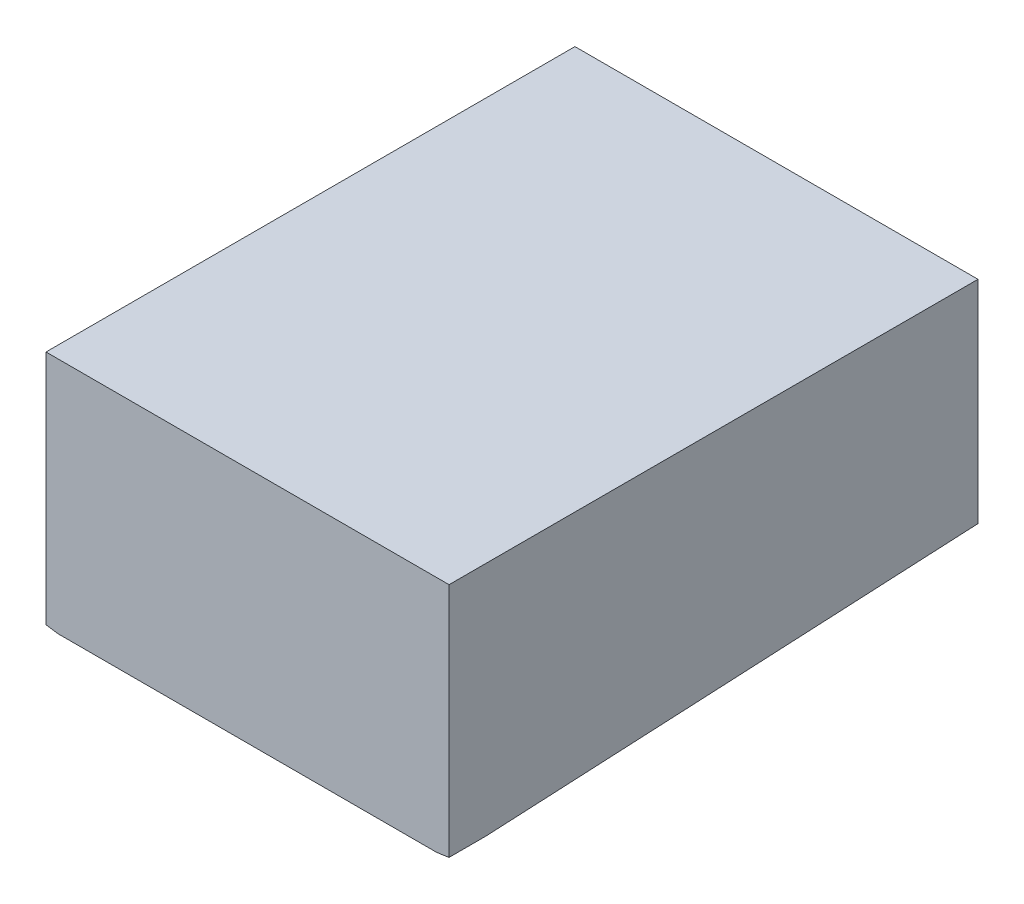
from build123d import *

# Parameters (mm, degrees)
BOSS_EXTRUDE1_DEPTH     = 200
CUT_EXTRUDE1_DEPTH      = 241.63756996204893
CUT_EXTRUDE1_DEPTH_BACK = 241.63756996204893


with BuildPart() as part:
    # Sketch17 → Boss-Extrude1 (new body)
    with BuildSketch(Plane.XY):
        with BuildLine():
            Line((-76.19999999999997, -15), (76.2, -14.99999999999998))
            Line((76.2, -14.99999999999998), (76.19999999999918, -104.30840989584696))
            add(Edge.make_bspline(
                [(-76.19999999999918, -104.30840989584696), (2.649e-14, -116.002151811939), (76.19999999999918, -104.30840989584696)],
                knots=[1.2477044197570988, 1.2477044197570988, 1.2477044197570988, 1.8938882338326948, 1.8938882338326948, 1.8938882338326948], degree=2, weights=[1, 0.948258271780427, 1]))
            Line((-76.19999999999918, -104.30840989584696), (-76.19999999999997, -15))
        make_face()
    extrude(amount=-BOSS_EXTRUDE1_DEPTH)

    # Sketch15 → Cut-Extrude1 (cut, two sides: drawn at the far end of the back side and taken through both)
    with BuildSketch(Plane(origin=(0, 0, 0), x_dir=(0, 0, -1), z_dir=(1, 0, 0)).offset(-CUT_EXTRUDE1_DEPTH_BACK)):
        Polygon((-4.29e-15, -110), (200, -110), (199.99999999999997, -95), (-4.9e-15, -105), align=None)
    extrude(amount=CUT_EXTRUDE1_DEPTH + CUT_EXTRUDE1_DEPTH_BACK, mode=Mode.SUBTRACT)


solid = part.part
